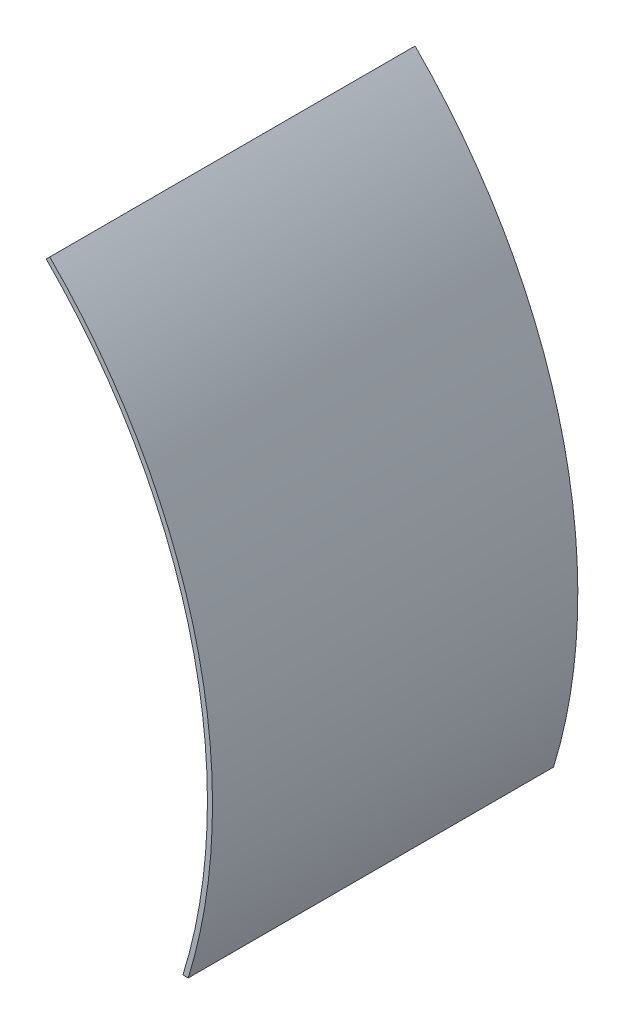
from build123d import *

# Parameters (mm, degrees)
BOSS_EXTRUDE1_DEPTH = 114.3


with BuildPart() as part:
    # Sketch1 → Boss-Extrude1 (new body)
    with BuildSketch(Plane.XY):
        with BuildLine():
            Line((121.794723642, 121.794723642), (122.917255657, 122.917255657))
            ThreePointArc((122.917255657, 122.917255657), (160.599133986, 66.522339402), (173.83125, 0))
            ThreePointArc((173.83125, 0), (171.923667002, -25.681826284), (166.242784735, -50.8))
            Line((166.242784735, -50.8), (164.582105388, -50.8))
            ThreePointArc((164.582105388, -50.8), (170.31756872, -25.687257532), (172.24375, 0))
            ThreePointArc((172.24375, 0), (159.132475228, 65.914829453), (121.794723642, 121.794723642))
        make_face()
    extrude(amount=BOSS_EXTRUDE1_DEPTH)


solid = part.part
